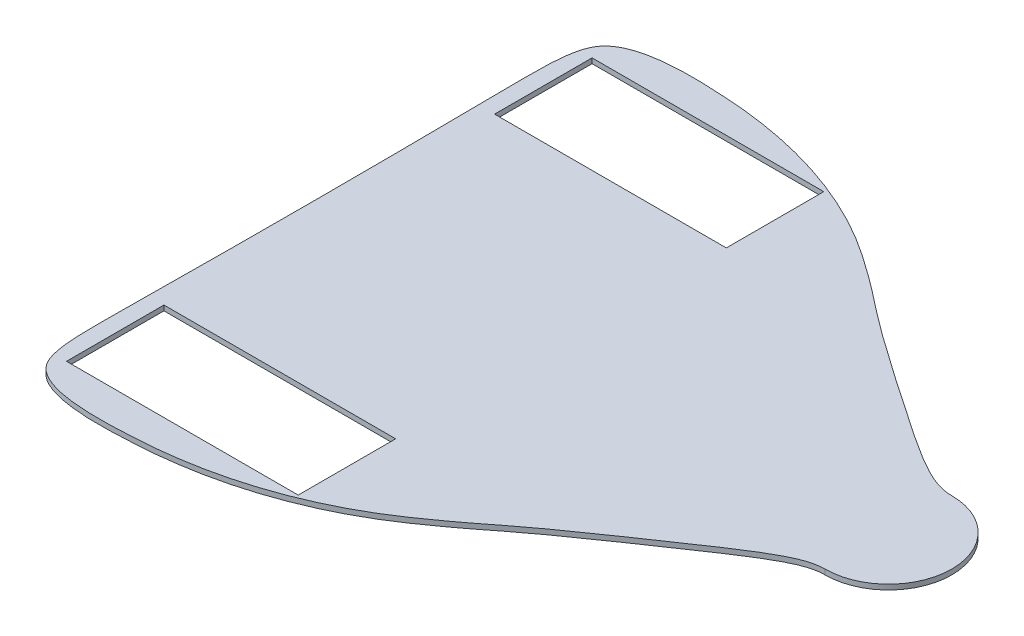
from build123d import *

# Parameters (mm, degrees)
BOSS_EXTRUDE1_DEPTH = 1.2
SKETCH2_W           = 54.8
SKETCH2_H           = 23.05
CUT_EXTRUDE1_DEPTH  = 154.138525906


with BuildPart() as part:
    # base dimensions → Boss-Extrude1 (new body)
    with BuildSketch(Plane(origin=(0, 0, 0), x_dir=(1, 0, 0), z_dir=(0, 1, 0))):
        with BuildLine():
            ThreePointArc((0, -15), (15, 0), (0, 15))
            add(Edge.make_bspline(
                [(0, 15), (-4.870078394, 15), (-11.569977851, 19.217117793), (-47.141427651, 43.632690178), (-47.290130315, 44.757767167), (-76.415981465, 65.555241473), (-102.151881277, 69.409481218), (-110.541531525, 69.848803499), (-132.389631197, 71.727717669), (-136.94710833, 56.908533844), (-135.85, 46.802208659), (-135.85, -46.802208659), (-136.94710833, -56.908533844), (-132.389631197, -71.727717669), (-110.541531525, -69.848803499), (-102.151881277, -69.409481218), (-76.415981465, -65.555241473), (-47.290130315, -44.757767167), (-47.141427651, -43.632690178), (-11.569977851, -19.217117793), (-4.870078394, -15), (0, -15)],
                knots=[0, 0, 0, 0, 0.067079231, 0.083663606, 0.156712623, 0.181874966, 0.310124696, 0.366503961, 0.689288347, 0.756672756, 1, 1, 1.243327244, 1.310711653, 1.633496039, 1.689875304, 1.818125034, 1.843287377, 1.916336394, 1.932920769, 2, 2, 2, 2], degree=3))
        make_face()
    extrude(amount=-BOSS_EXTRUDE1_DEPTH)

    # Sketch2 → Cut-Extrude1 (cut, through all)
    with BuildSketch(Plane(origin=(0, -1.2, 0), x_dir=(-1, 0, 0), z_dir=(0, -1, 0))):
        with Locations((104.85, 50.625)):
            Rectangle(SKETCH2_W, SKETCH2_H)
        with Locations((104.85, -50.625)):
            Rectangle(SKETCH2_W, SKETCH2_H)
    extrude(amount=-CUT_EXTRUDE1_DEPTH, mode=Mode.SUBTRACT)


solid = part.part
